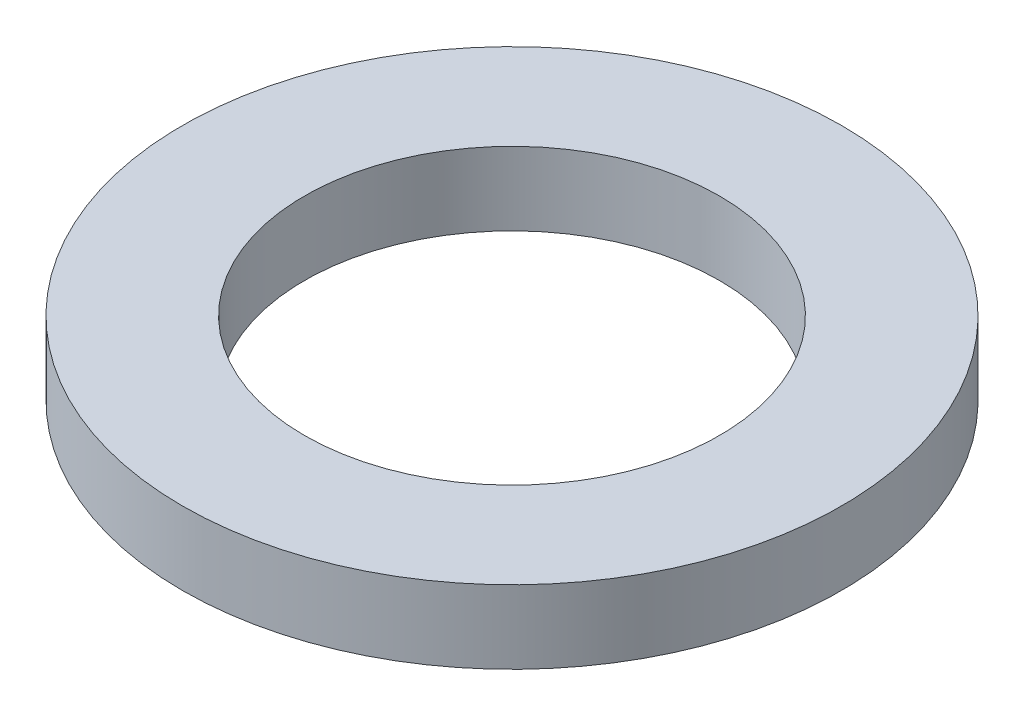
from build123d import *

# Parameters (mm, degrees)
SKETCH1_R           = 67.5
BOSS_EXTRUDE1_DEPTH = 15
SKETCH2_R           = 42.5
CUT_EXTRUDE1_DEPTH  = 97.63074045


with BuildPart() as part:
    # Sketch1 → Boss-Extrude1 (new body)
    with BuildSketch(Plane(origin=(0, 0, 0), x_dir=(1, 0, 0), z_dir=(0, 1, 0))):
        Circle(SKETCH1_R)
    extrude(amount=BOSS_EXTRUDE1_DEPTH)

    # Sketch2 → Cut-Extrude1 (cut, through all)
    with BuildSketch(Plane(origin=(0, 0, 0), x_dir=(1, 0, 0), z_dir=(0, 1, 0))):
        Circle(SKETCH2_R)
    extrude(amount=CUT_EXTRUDE1_DEPTH, mode=Mode.SUBTRACT)


solid = part.part
